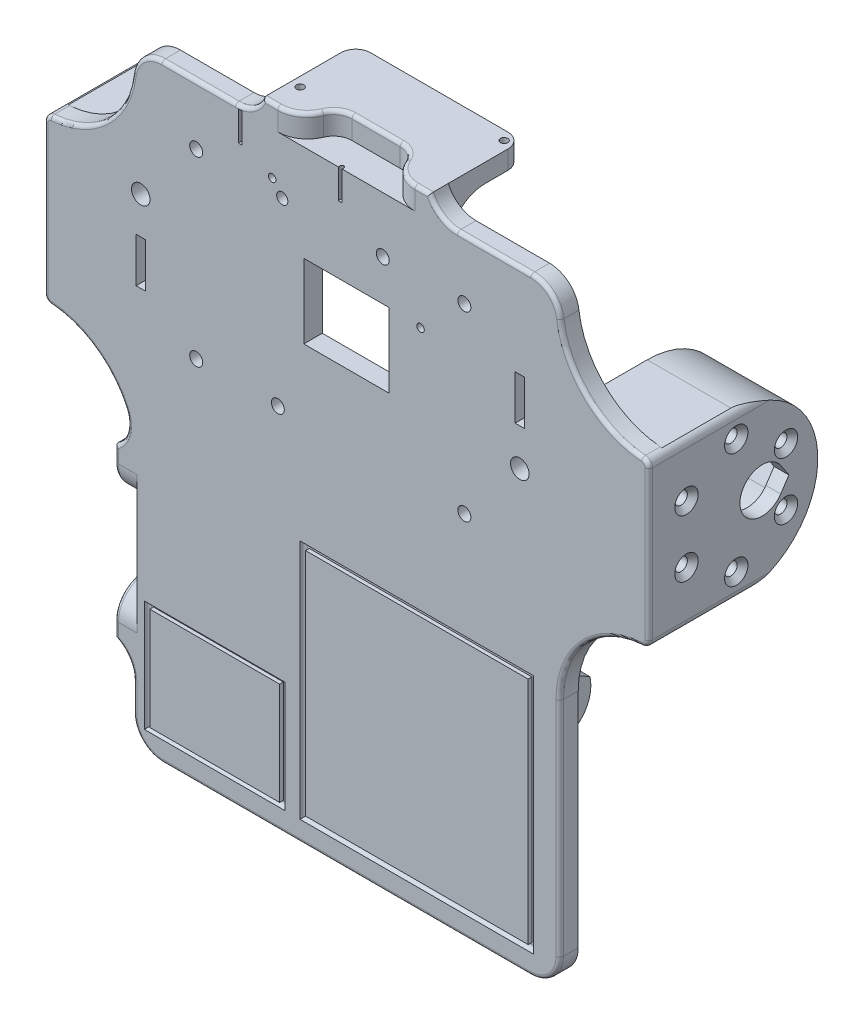
from build123d import *

# Parameters (mm, degrees)
SKETCH1_W                                      = 115
SKETCH1_H                                      = 100
SKETCH1_R                                      = 1.75
BOSS_EXTRUDE1_DEPTH                            = 5
SKETCH2_W                                      = 115
SKETCH2_H                                      = 64
BOSS_EXTRUDE2_DEPTH                            = 5
SKETCH4_W                                      = 45
SKETCH4_H                                      = 25
BOSS_EXTRUDE3_DEPTH                            = 5
SKETCH5_R                                      = 1
CUT_EXTRUDE2_DEPTH                             = 206.392307548
FILLET1_R                                      = 10
SKETCH6_R                                      = 2.25
CUT_EXTRUDE3_DEPTH                             = 202.298286133
SKETCH7_W                                      = 23
SKETCH7_H                                      = 8
CUT_EXTRUDE4_DEPTH                             = 6
SKETCH8_R                                      = 1
SKETCH8_W                                      = 23
SKETCH8_H                                      = 20
CUT_EXTRUDE5_DEPTH                             = 158.003184681
SKETCH9_R                                      = 18.5
BOSS_EXTRUDE4_DEPTH                            = 20
SKETCH10_R                                     = 6
BOSS_EXTRUDE5_DEPTH                            = 4
CSK_FOR_M3_FLAT_HEAD_MACHINE_SCREW1_AT_2_COUNT = 2
CSK_FOR_M3_FLAT_HEAD_MACHINE_SCREW1_AT_2_PITCH = 15.5
CSK_FOR_M3_FLAT_HEAD_MACHINE_SCREW1_AT_3_COUNT = 2
CSK_FOR_M3_FLAT_HEAD_MACHINE_SCREW1_AT_3_PITCH = 26.846787517
CSK_FOR_M3_FLAT_HEAD_MACHINE_SCREW1_AT_4_COUNT = 2
CSK_FOR_M3_FLAT_HEAD_MACHINE_SCREW1_AT_4_PITCH = 31
CSK_FOR_M3_FLAT_HEAD_MACHINE_SCREW1_AT_5_COUNT = 2
CSK_FOR_M3_FLAT_HEAD_MACHINE_SCREW1_AT_5_PITCH = 26.846787517
CSK_FOR_M3_FLAT_HEAD_MACHINE_SCREW1_AT_6_COUNT = 2
CSK_FOR_M3_FLAT_HEAD_MACHINE_SCREW1_AT_6_PITCH = 15.5
BOSS_EXTRUDE6_DEPTH                            = 5
SKETCH16_R                                     = 3.5
BOSS_EXTRUDE7_DEPTH                            = 10
FILLET3_R                                      = 20
FILLET4_R                                      = 5
SKETCH19_W                                     = 25
SKETCH19_H                                     = 45
BOSS_EXTRUDE9_DEPTH                            = 5
SKETCH20_R                                     = 1
CUT_EXTRUDE6_DEPTH                             = 5
FILLET5_R                                      = 10
SKETCH21_W                                     = 8
SKETCH21_H                                     = 23
CUT_EXTRUDE7_DEPTH                             = 6
SKETCH22_R                                     = 2.25
CUT_EXTRUDE8_DEPTH                             = 15
SKETCH23_R                                     = 2.5
SKETCH23_W                                     = 2.5
SKETCH23_H                                     = 12
CUT_EXTRUDE10_DEPTH                            = 22
SKETCH3_W                                      = 63
SKETCH3_H                                      = 65
SKETCH3_W_2                                    = 60
SKETCH3_H_2                                    = 62
SKETCH3_W_3                                    = 38
SKETCH3_H_3                                    = 30
SKETCH3_W_4                                    = 35
SKETCH3_H_4                                    = 27.631578948
CUT_EXTRUDE11_DEPTH                            = 1
FILLET6_R                                      = 1
FILLET7_R                                      = 5
CUT_EXTRUDE12_DEPTH                            = 20
CUT_EXTRUDE13_DEPTH                            = 196.511386402
CUT_EXTRUDE14_DEPTH                            = 20
CUT_EXTRUDE15_REACH                            = 152.551
FILLET8_R                                      = 8
FILLET9_R                                      = 4
CUT_EXTRUDE16_DEPTH                            = 181.908076505
FILLET10_R                                     = 1
SKETCH30_W                                     = 1
SKETCH30_H                                     = 8
CUT_EXTRUDE17_DEPTH                            = 1
FILLET11_R                                     = 0.5
SKETCH31_R                                     = 1.75
CUT_EXTRUDE18_DEPTH                            = 181.90807664
SKETCH32_R                                     = 2.5
SKETCH32_W                                     = 2.5
SKETCH32_H                                     = 12
CUT_EXTRUDE19_DEPTH                            = 181.90807664
SKETCH33_R                                     = 1.5
CUT_EXTRUDE20_DEPTH                            = 181.90807664


# Some blends are built 0.0001 mm under size
with BuildPart() as part:
    # Sketch1 → Boss-Extrude1 (new body)
    with BuildSketch(Plane.XY):
        with Locations((57.5, 50)):
            Rectangle(SKETCH1_W, SKETCH1_H)
        with Locations((67.3, 84)):
            Circle(SKETCH1_R, mode=Mode.SUBTRACT)
        with Locations((89.3, 35)):
            Circle(SKETCH1_R, mode=Mode.SUBTRACT)
        with Locations((17, 35)):
            Circle(SKETCH1_R, mode=Mode.SUBTRACT)
    extrude(amount=BOSS_EXTRUDE1_DEPTH)

    # Sketch2 → Boss-Extrude2 (add)
    with BuildSketch(Plane.XY.offset(5)):
        with Locations((57.5, -32)):
            Rectangle(SKETCH2_W, SKETCH2_H)
    extrude(amount=-BOSS_EXTRUDE2_DEPTH)

    # Sketch4 → Boss-Extrude3 (add)
    with BuildSketch(Plane(origin=(0, 100, 0), x_dir=(1, 0, 0), z_dir=(0, 1, 0))):
        with Locations((57.5, 7.5)):
            Rectangle(SKETCH4_W, SKETCH4_H)
    extrude(amount=BOSS_EXTRUDE3_DEPTH)

    # Sketch5 → Cut-Extrude2 (cut, through all)
    with BuildSketch(Plane(origin=(0, 105, 0), x_dir=(1, 0, 0), z_dir=(0, 1, 0))):
        with Locations(Location((37.5, 2.5, 0), (0, 0, 270))):
            Circle(SKETCH5_R)
        with Locations(Location((77.5, 17.5, 0), (0, 0, 270))):
            Circle(SKETCH5_R)
    extrude(amount=-CUT_EXTRUDE2_DEPTH, mode=Mode.SUBTRACT)

    # Fillet1
    # the kernel refuses this fillet: 10 mm, written as the material it adds along each edge
    with BuildSketch(Plane(origin=(80, 100, 0), x_dir=(0, -1, 0), z_dir=(-1, 0, 0))) as fillet1_piece_1_section:
        with BuildLine():
            CenterArc((FILLET1_R, -FILLET1_R), FILLET1_R, 90, 90)
            Line((0, -FILLET1_R), (0, 0))
            Line((0, 0), (FILLET1_R, 0))
        make_face()
    fillet1_piece_1 = extrude(amount=45, mode=Mode.PRIVATE)
    fillet1_piece_1 = fillet1_piece_1 - Plane(origin=(37.5, 100, -2.5), x_dir=(0, 0, 1), z_dir=(0, 1, 0)) * Cylinder(1, 130, mode=Mode.PRIVATE)
    add(fillet1_piece_1)

    # Sketch6 → Cut-Extrude3 (cut, through all)
    with BuildSketch(Plane.XZ.offset(-100)):
        with Locations(Location((37.5, -2.5, 0), (0, 0, 90))):
            Circle(SKETCH6_R)
    extrude(amount=CUT_EXTRUDE3_DEPTH, mode=Mode.SUBTRACT)

    # Sketch7 → Cut-Extrude4 (cut)
    with BuildSketch(Plane(origin=(0, 105, 0), x_dir=(1, 0, 0), z_dir=(0, 1, 0))):
        with Locations((57.5, -1)):
            Rectangle(SKETCH7_W, SKETCH7_H)
    extrude(amount=-CUT_EXTRUDE4_DEPTH, mode=Mode.SUBTRACT)

    # Sketch8 → Cut-Extrude5 (cut, through all)
    with BuildSketch(Plane(origin=(0, 0, 0), x_dir=(-1, 0, 0), z_dir=(0, 0, -1))):
        with Locations((-37.5, 87.5)):
            Circle(SKETCH8_R)
        with Locations((-77.5, 72.5)):
            Circle(SKETCH8_R)
        with Locations((-57.5, 63)):
            Rectangle(SKETCH8_W, SKETCH8_H)
    extrude(amount=-CUT_EXTRUDE5_DEPTH, mode=Mode.SUBTRACT)


with BuildPart() as body_2:
    # Sketch9 → Boss-Extrude4 (new body)
    with BuildSketch(Plane(origin=(115, 0, 0), x_dir=(0, 0, -1), z_dir=(1, 0, 0))):
        with BuildLine():
            Line((18.6, 72), (0, 72))
            Line((0, 72), (-5, 72))
            Line((-5, 72), (-5, 28))
            Line((-5, 28), (0, 28))
            Line((0, 28), (18.6, 28))
            ThreePointArc((18.6, 28), (40.6, 50), (18.6, 72))
        make_face()
        with Locations((18.6, 50)):
            Circle(SKETCH9_R, mode=Mode.SUBTRACT)
    boss_extrude4 = extrude(amount=BOSS_EXTRUDE4_DEPTH)

    # Sketch10 → Boss-Extrude5 (add)
    with BuildSketch(Plane(origin=(135, 0, 0), x_dir=(0, 0, -1), z_dir=(1, 0, 0))):
        with BuildLine():
            Line((-5, 28), (18.6, 28))
            ThreePointArc((18.6, 28), (40.6, 50), (18.6, 72))
            Line((18.6, 72), (-5, 72))
            Line((-5, 72), (-5, 28))
        make_face()
        with Locations((25.6, 50)):
            Circle(SKETCH10_R, mode=Mode.SUBTRACT)
    boss_extrude5 = extrude(amount=BOSS_EXTRUDE5_DEPTH)

    # Sketch12 → CSK for M3 Flat Head Machine Screw1 (revolve, cut)
    with BuildSketch(Plane(origin=(139, 57.75, -32.023393759), x_dir=(0, 0, -1), z_dir=(0, 1, 0))):
        Polygon((0, 0), (0, 139), (1.7, 139), (1.7, 1.45), (3.15, 0), align=None)
    csk_for_m3_flat_head_machine_screw1 = revolve(axis=Axis((145.35, 57.75, -32.023393759), (-1, 0, 0)), mode=Mode.SUBTRACT)

    # CSK for M3 Flat Head Machine Screw1 at 2: CSK for M3 Flat Head Machine Screw1 ×2
    with Locations(*[Vector(0, 0.500000000000113, 0.8660254037843734) * (i * CSK_FOR_M3_FLAT_HEAD_MACHINE_SCREW1_AT_2_PITCH) for i in range(1, CSK_FOR_M3_FLAT_HEAD_MACHINE_SCREW1_AT_2_COUNT)]):
        add(csk_for_m3_flat_head_machine_screw1, mode=Mode.SUBTRACT)

    # CSK for M3 Flat Head Machine Screw1 at 3: CSK for M3 Flat Head Machine Screw1 ×2
    with Locations(*[(0, 0, i * CSK_FOR_M3_FLAT_HEAD_MACHINE_SCREW1_AT_3_PITCH) for i in range(1, CSK_FOR_M3_FLAT_HEAD_MACHINE_SCREW1_AT_3_COUNT)]):
        add(csk_for_m3_flat_head_machine_screw1, mode=Mode.SUBTRACT)

    # CSK for M3 Flat Head Machine Screw1 at 4: CSK for M3 Flat Head Machine Screw1 ×2
    with Locations(*[Vector(0, -0.49999999999988537, 0.8660254037845048) * (i * CSK_FOR_M3_FLAT_HEAD_MACHINE_SCREW1_AT_4_PITCH) for i in range(1, CSK_FOR_M3_FLAT_HEAD_MACHINE_SCREW1_AT_4_COUNT)]):
        add(csk_for_m3_flat_head_machine_screw1, mode=Mode.SUBTRACT)

    # CSK for M3 Flat Head Machine Screw1 at 5: CSK for M3 Flat Head Machine Screw1 ×2
    with Locations(*[Vector(0, -0.8660254037843725, 0.5000000000001145) * (i * CSK_FOR_M3_FLAT_HEAD_MACHINE_SCREW1_AT_5_PITCH) for i in range(1, CSK_FOR_M3_FLAT_HEAD_MACHINE_SCREW1_AT_5_COUNT)]):
        add(csk_for_m3_flat_head_machine_screw1, mode=Mode.SUBTRACT)

    # CSK for M3 Flat Head Machine Screw1 at 6: CSK for M3 Flat Head Machine Screw1 ×2
    with Locations(*[(0, -i * CSK_FOR_M3_FLAT_HEAD_MACHINE_SCREW1_AT_6_PITCH, 0) for i in range(1, CSK_FOR_M3_FLAT_HEAD_MACHINE_SCREW1_AT_6_COUNT)]):
        add(csk_for_m3_flat_head_machine_screw1, mode=Mode.SUBTRACT)


with BuildPart() as part_1:
    add(part.part)

    # Mirror10: Boss-Extrude4, Boss-Extrude5, CSK for M3 Flat Head Machine Screw1 across plane
    add(boss_extrude4.mirror(Plane.ZY.offset(-57.5)))
    add(boss_extrude5.mirror(Plane.ZY.offset(-57.5)))
    add(csk_for_m3_flat_head_machine_screw1.mirror(Plane.ZY.offset(-57.5)), mode=Mode.SUBTRACT)

    # Mirror10 copy 1 sketch → Mirror10 copy 1 (revolve, cut)
    with BuildSketch(Plane(origin=(-24, 65.5, -18.6), x_dir=(0, 0, -1), z_dir=(0, 1, 0))):
        Polygon((0, 0), (0, -139), (1.7, -139), (1.7, -1.45), (3.15, 0), align=None)
    revolve(axis=Axis((-30.35, 65.5, -18.6), (-1, 0, 0)), mode=Mode.SUBTRACT)

    # Mirror10 copy 2 sketch → Mirror10 copy 2 (revolve, cut)
    with BuildSketch(Plane(origin=(-24, 57.75, -5.176606241), x_dir=(0, 0, -1), z_dir=(0, 1, 0))):
        Polygon((0, 0), (0, -139), (1.7, -139), (1.7, -1.45), (3.15, 0), align=None)
    revolve(axis=Axis((-30.35, 57.75, -5.176606241), (-1, 0, 0)), mode=Mode.SUBTRACT)

    # Mirror10 copy 3 sketch → Mirror10 copy 3 (revolve, cut)
    with BuildSketch(Plane(origin=(-24, 42.25, -5.176606241), x_dir=(0, 0, -1), z_dir=(0, 1, 0))):
        Polygon((0, 0), (0, -139), (1.7, -139), (1.7, -1.45), (3.15, 0), align=None)
    revolve(axis=Axis((-30.35, 42.25, -5.176606241), (-1, 0, 0)), mode=Mode.SUBTRACT)

    # Mirror10 copy 4 sketch → Mirror10 copy 4 (revolve, cut)
    with BuildSketch(Plane(origin=(-24, 34.5, -18.6), x_dir=(0, 0, -1), z_dir=(0, 1, 0))):
        Polygon((0, 0), (0, -139), (1.7, -139), (1.7, -1.45), (3.15, 0), align=None)
    revolve(axis=Axis((-30.35, 34.5, -18.6), (-1, 0, 0)), mode=Mode.SUBTRACT)

    # Mirror10 copy 5 sketch → Mirror10 copy 5 (revolve, cut)
    with BuildSketch(Plane(origin=(-24, 42.25, -32.023393759), x_dir=(0, 0, -1), z_dir=(0, 1, 0))):
        Polygon((0, 0), (0, -139), (1.7, -139), (1.7, -1.45), (3.15, 0), align=None)
    revolve(axis=Axis((-30.35, 42.25, -32.023393759), (-1, 0, 0)), mode=Mode.SUBTRACT)

    add(body_2.part)  # Boss-Extrude6 merges body 2
    # Sketch15 → Boss-Extrude6 (add)
    with BuildSketch(Plane(origin=(0, 0, 0), x_dir=(-1, 0, 0), z_dir=(0, 0, -1))):
        with BuildLine():
            Line((24, 72), (0, 72))
            Line((0, 72), (0, 96))
            ThreePointArc((0, 96), (7.029437252, 79.029437252), (24, 72))
        make_face()
        with BuildLine():
            Line((24, 28), (0, 28))
            Line((0, 28), (0, 4))
            ThreePointArc((0, 4), (7.029437252, 20.970562748), (24, 28))
        make_face()
        with BuildLine():
            Line((-115, 4), (-115, 28))
            Line((-115, 28), (-139, 28))
            ThreePointArc((-139, 28), (-122.029437252, 20.970562748), (-115, 4))
        make_face()
        with BuildLine():
            Line((-115, 96), (-115, 72))
            Line((-115, 72), (-139, 72))
            ThreePointArc((-139, 72), (-122.029437252, 79.029437252), (-115, 96))
        make_face()
    extrude(amount=-BOSS_EXTRUDE6_DEPTH)

    # Sketch16 → Boss-Extrude7 (add)
    with BuildSketch(Plane.ZY.offset(-50.4)):
        with BuildLine():
            Line((0, -9.511734706), (-32.831780912, -28.467172254))
            Line((-32.831780912, -28.467172254), (-43.545593688, -34.652794944))
            ThreePointArc((-43.545593688, -34.652794944), (-42.536532248, -41.57021305), (-37.05040316, -45.902794944))
            Line((-37.05040316, -45.902794944), (-28.173771731, -40.777869399))
            Line((-28.173771731, -40.777869399), (0, -24.511734706))
            Line((0, -24.511734706), (0, -9.511734706))
        make_face()
        with Locations((-34.35, -36.843716453)):
            Circle(SKETCH16_R, mode=Mode.SUBTRACT)
    boss_extrude7 = extrude(amount=BOSS_EXTRUDE7_DEPTH)

    # Mirror11: Boss-Extrude7 across plane
    add(boss_extrude7.mirror(Plane.ZY.offset(-57.5)))

    # Fillet3
    fillet3_edges = [part_1.edges().sort_by_distance(p)[0] for p in [
        (40.4, -17.011734706, 0),
        (74.6, -17.011734706, 0),
    ]]
    fillet(fillet3_edges, radius=FILLET3_R)

    # Fillet4
    fillet4_edges = [part_1.edges().sort_by_distance(p)[0] for p in [
        (35.4, -24.511734706, 0),
        (79.6, -24.511734706, 0),
        (35.4, -9.511734706, 0),
        (79.6, -9.511734706, 0),
    ]]
    fillet(fillet4_edges, radius=FILLET4_R)

    # Sketch19 → Boss-Extrude9 (add)
    with BuildSketch(Plane.ZY):
        with Locations((-7.5, -18.5)):
            Rectangle(SKETCH19_W, SKETCH19_H)
    extrude(amount=BOSS_EXTRUDE9_DEPTH)

    # Sketch20 → Cut-Extrude6 (cut)
    with BuildSketch(Plane.ZY.offset(5)):
        with Locations((-17.5, 1.5)):
            Circle(SKETCH20_R)
        with Locations((-2.5, -38.5)):
            Circle(SKETCH20_R)
    extrude(amount=-CUT_EXTRUDE6_DEPTH, mode=Mode.SUBTRACT)

    # Fillet5
    # the kernel refuses this fillet: 10 mm, written as the material it adds along each edge
    with BuildSketch(Plane(origin=(0, -41, 0), x_dir=(1, 0, 0), z_dir=(0, 1, 0))) as fillet5_piece_1_section:
        with BuildLine():
            CenterArc((FILLET5_R, FILLET5_R), FILLET5_R, 180, 90)
            Line((0, FILLET5_R), (0, 0))
            Line((0, 0), (FILLET5_R, 0))
        make_face()
    fillet5_piece_1 = extrude(amount=45, mode=Mode.PRIVATE)
    fillet5_piece_1 = fillet5_piece_1 - Plane(origin=(0, -38.5, -2.5), x_dir=(0, 0, 1), z_dir=(-1, 0, 0)) * Cylinder(1, 130, mode=Mode.PRIVATE)
    add(fillet5_piece_1)

    # Sketch21 → Cut-Extrude7 (cut)
    with BuildSketch(Plane.ZY.offset(5)):
        with Locations((1, -18.5)):
            Rectangle(SKETCH21_W, SKETCH21_H)
    extrude(amount=-CUT_EXTRUDE7_DEPTH, mode=Mode.SUBTRACT)

    # Sketch22 → Cut-Extrude8 (cut)
    with BuildSketch(Plane(origin=(0, 0, 0), x_dir=(0, 0, -1), z_dir=(1, 0, 0))):
        with Locations(Location((2.5, -38.5, 0), (0, 0, 180))):
            Circle(SKETCH22_R)
    extrude(amount=CUT_EXTRUDE8_DEPTH, mode=Mode.SUBTRACT)

    # Sketch23 → Cut-Extrude10 (cut)
    with BuildSketch(Plane.XY.offset(5)):
        with Locations((104.25, 53)):
            Circle(SKETCH23_R)
        with Locations((104.25, 69)):
            Rectangle(SKETCH23_W, SKETCH23_H)
    extrude(amount=-CUT_EXTRUDE10_DEPTH, mode=Mode.SUBTRACT)

    # Sketch3 → Cut-Extrude11 (cut)
    # profile 1 of 2: a face of its own
    with BuildSketch(Plane.XY.offset(5)):
        with Locations((76.5, -26)):
            Rectangle(SKETCH3_W, SKETCH3_H)
        with Locations((76.5, -26)):
            Rectangle(SKETCH3_W_2, SKETCH3_H_2, mode=Mode.SUBTRACT)
    # profile 2 of 2: a face of its own
    with BuildSketch(Plane.XY.offset(5)):
        with Locations((22, -43.5)):
            Rectangle(SKETCH3_W_3, SKETCH3_H_3)
        with Locations((22, -43.5)):
            Rectangle(SKETCH3_W_4, SKETCH3_H_4, mode=Mode.SUBTRACT)
    extrude(amount=-CUT_EXTRUDE11_DEPTH, mode=Mode.SUBTRACT)

    # Fillet6
    fillet6_edges = [part_1.edges().sort_by_distance(p)[0] for p in [
        (76.5, -58.5, 4),
        (108, -26, 4),
        (76.5, 6.5, 4),
        (45, -26, 4),
        (22, -58.5, 4),
        (41, -43.5, 4),
        (22, -28.5, 4),
        (3, -43.5, 4),
    ]]
    fillet(fillet6_edges, radius=FILLET6_R - 0.0001)  # a hair under: the kernel refuses the full size

    # Fillet7
    fillet7_edges = [part_1.edges().sort_by_distance(p)[0] for p in [
        (46, 102, -3),
        (69, 102, -3),
        (-2, -30, -3),
        (-2, -7, -3),
    ]]
    fillet(fillet7_edges, radius=FILLET7_R)

    # Sketch24 → Cut-Extrude12 (cut)
    with BuildSketch(Plane.ZY.offset(-115)):
        with BuildLine():
            Line((-35.056989836, 41.549113328), (-39.396634343, 50))
            Line((-39.396634343, 50), (-35.056989836, 58.450886672))
            ThreePointArc((-35.056989836, 58.450886672), (-37.1, 50), (-35.056989836, 41.549113328))
        make_face()
    extrude(amount=-CUT_EXTRUDE12_DEPTH, mode=Mode.SUBTRACT)

    # Sketch25 → Cut-Extrude13 (cut, through all)
    with BuildSketch(Plane.ZY.offset(-135)):
        with BuildLine():
            Line((-30.592301766, 46.671798823), (-32.811102551, 50))
            Line((-32.811102551, 50), (-30.592301766, 53.328201177))
            ThreePointArc((-30.592301766, 53.328201177), (-31.6, 50), (-30.592301766, 46.671798823))
        make_face()
    cut_extrude13 = extrude(amount=-CUT_EXTRUDE13_DEPTH, mode=Mode.SUBTRACT)

    # Mirror14: Cut-Extrude13 across plane
    add(cut_extrude13.mirror(Plane.ZY.offset(-57.5)), mode=Mode.SUBTRACT)

    # Sketch26 → Cut-Extrude14 (cut)
    with BuildSketch(Plane(origin=(0, 0, 0), x_dir=(0, 0, -1), z_dir=(1, 0, 0))):
        with BuildLine():
            Line((35.056989836, 58.450886672), (39.396634343, 50))
            Line((39.396634343, 50), (35.056989836, 41.549113328))
            ThreePointArc((35.056989836, 41.549113328), (37.1, 50), (35.056989836, 58.450886672))
        make_face()
    extrude(amount=-CUT_EXTRUDE14_DEPTH, mode=Mode.SUBTRACT)

    # Cut-Extrude15: up to this face of the body (flat: up to its plane)
    cut_extrude15_end = Plane(part_1.part.faces().sort_by_distance((40.4, -34.236342604, -30.563620444))[0])
    # Sketch27 → Cut-Extrude15 (cut, up to the picked face)
    with BuildSketch(Plane(origin=(74.6, 0, 0), x_dir=(0, 0, -1), z_dir=(1, 0, 0)), mode=Mode.PRIVATE) as cut_extrude15_sk1:
        with BuildLine():
            Line((36.654766128, -39.477734884), (39.665072906, -36.843716453))
            Line((39.665072906, -36.843716453), (36.654766128, -34.209698021))
            ThreePointArc((36.654766128, -34.209698021), (37.85, -36.843716453), (36.654766128, -39.477734884))
        make_face()
    cut_extrude15_tool1 = split(extrude(cut_extrude15_sk1.sketch, amount=-CUT_EXTRUDE15_REACH, mode=Mode.PRIVATE), bisect_by=cut_extrude15_end, keep=Keep.BOTH, mode=Mode.PRIVATE)
    add(cut_extrude15_tool1.solids().sort_by(Axis((74.6, -36.843716, -38.292316), (-1, 0, 0)))[0], mode=Mode.SUBTRACT)

    # Fillet8
    # the kernel refuses this fillet: 8 mm, written as the material it adds along each edge
    with BuildSketch(Plane(origin=(80, 100, 5), x_dir=(1, 0, 0), z_dir=(0, 0, -1)), Plane(origin=(35, 100, 0), x_dir=(-1, 0, 0), z_dir=(0, 0, 1))) as fillet8_piece_1:
        with BuildLine():
            CenterArc((7.416198487, -8), FILLET8_R, 90, 67.975687163)
            Line((0, -5), (0, 0))
            Line((0, 0), (7.416198487, 0))
        make_face()
    extrude(amount=5)
    with BuildSketch(Plane(origin=(0, -41, 0), x_dir=(-1, 0, 0), z_dir=(0, 0, 1))) as fillet8_piece_2:
        with BuildLine():
            CenterArc((8, 7.416198487), FILLET8_R, 180, 67.975687163)
            Line((0, 7.416198487), (0, 0))
            Line((0, 0), (5, 0))
        make_face()
    extrude(amount=5)
    with BuildSketch(Plane(origin=(0, 4, 0), x_dir=(-0.2126740773058503, 0.9771231943015708, 0), z_dir=(0, 0, 1))) as fillet8_piece_3:
        with BuildLine():
            CenterArc((8.506963092, 7.816985554), FILLET8_R, 201.495071849, 80.784034357)
            Line((1.063370387, 4.885615972), (0, 0))
            ThreePointArc((0, 0), (5.104177855, -0.549043337), (10.208355711, 0))
        make_face()
    extrude(amount=5)
    # the kernel refuses this fillet: 8 mm, written as the material it takes off along each edge
    with BuildSketch(Plane(origin=(0, 100, -19.372539332), x_dir=(1, 0, 0), z_dir=(0, 0, 1))) as fillet8_2_piece_1:
        with BuildLine():
            CenterArc((7.749015733, -8), FILLET8_R, 90, 82.819244219)
            Line((-0.1882382, -7), (-0.981963594, -6.9))
            ThreePointArc((-0.981963594, -6.9), (-0.8, -4), (-0.8, 0))
            Line((-0.8, 0), (0, 0.8))
            Line((0, 0.8), (7.749015733, 0.8))
            Line((7.749015733, 0.8), (7.749015733, 0))
        make_face()
    extrude(amount=43.745078664, mode=Mode.SUBTRACT)
    with BuildSketch(Plane(origin=(115, 100, -19.372539332), x_dir=(0.026881453783434036, -0.9996386284265374, 0), z_dir=(0, 0, 1))) as fillet8_2_piece_2:
        with BuildLine():
            CenterArc((7.788804219, -7.961267089), FILLET8_R, 95.640376378, 82.819244219)
            Line((-0.208304808, -7.746215459), (-1.008015711, -7.724710296))
            Line((-1.008015711, -7.724710296), (-0.799710903, 0.021505163))
            Line((-0.799710903, 0.021505163), (0.021505163, 0.799710903))
            ThreePointArc((0.021505163, 0.799710903), (4.020059677, 0.692185088), (6.923903145, 0.796126709))
            Line((6.923903145, 0.796126709), (7.002530515, 0))
        make_face()
    extrude(amount=43.745078664, mode=Mode.SUBTRACT)
    with BuildSketch(Plane(origin=(115, -64, 25), x_dir=(-1, 0, 0), z_dir=(0, 0, -1)), Plane(origin=(0, -64, 25), x_dir=(0, 1, 0), z_dir=(0, 0, -1))) as fillet8_2_piece_3:
        with BuildLine():
            CenterArc((FILLET8_R, FILLET8_R), FILLET8_R, 180, 90)
            Line((0, FILLET8_R), (0, 0))
            Line((0, 0), (FILLET8_R, 0))
        make_face()
    extrude(amount=45, mode=Mode.SUBTRACT)
    with BuildSketch(Plane(origin=(46, 122.5, 5), x_dir=(0.07788766729290894, 0, -0.9969621413492437), z_dir=(0, -1, 0)), Plane(origin=(-22.5, -30, 5), x_dir=(0, 0.07788766729290754, -0.9969621413492438), z_dir=(1, 0, 0))) as fillet8_2_piece_4:
        with BuildLine():
            CenterArc((7.43048346, -7.601836328), FILLET8_R, 108.152705887, 67.380135052)
            Line((-0.545213671, -6.978734989), (-1.342783384, -6.916424856))
            Line((-1.342783384, -6.916424856), (-0.797569713, 0.062310134))
            Line((-0.797569713, 0.062310134), (0.062310134, 0.797569713))
            ThreePointArc((0.062310134, 0.797569713), (3.053196558, 0.563906711), (4.688837571, 0.760183633))
            Line((4.688837571, 0.760183633), (4.938078106, 0))
        make_face()
    extrude(amount=23.5, mode=Mode.SUBTRACT)
    with BuildSketch(Plane(origin=(69, 122.5, 5), x_dir=(1, 0, 0), z_dir=(0, -1, 0))) as fillet8_2_piece_5:
        with BuildLine():
            CenterArc((7, -8), FILLET8_R, 90, 67.380135052)
            Line((-0.384615385, -4.923076923), (-1.123076923, -4.615384615))
            ThreePointArc((-1.123076923, -4.615384615), (-0.8, -3), (-0.8, 0))
            Line((-0.8, 0), (0, 0.8))
            Line((0, 0.8), (7, 0.8))
            Line((7, 0.8), (7, 0))
        make_face()
    extrude(amount=23.5, mode=Mode.SUBTRACT)
    with BuildSketch(Plane(origin=(-22.5, -7, 5), x_dir=(0, -0.07788766729290758, -0.9969621413492437), z_dir=(1, 0, 0))) as fillet8_2_piece_6:
        with BuildLine():
            CenterArc((7.43048346, 7.601836328), FILLET8_R, 184.467159061, 67.380135052)
            Line((-0.545213671, 6.978734989), (-1.342783384, 6.916424856))
            Line((-1.342783384, 6.916424856), (-0.797569713, -0.062310134))
            Line((-0.797569713, -0.062310134), (0.062310134, -0.797569713))
            ThreePointArc((0.062310134, -0.797569713), (3.053196558, -0.563906711), (4.688837571, -0.760183633))
            Line((4.688837571, -0.760183633), (4.938078106, 0))
        make_face()
    extrude(amount=23.5, mode=Mode.SUBTRACT)

    # Fillet9
    fillet9_edges = [part_1.edges().sort_by_distance(p)[0] for p in [
        (35, 102.5, -20),
        (80, 102.5, -20),
        (-2.5, -41, -20),
        (-2.5, 4, -20),
    ]]
    fillet(fillet9_edges, radius=FILLET9_R)

    # Sketch28 → Cut-Extrude16 (cut, through all)
    with BuildSketch(Plane.XY.offset(5)):
        with BuildLine():
            Line((-24, 72), (-24, 70.077037206))
            ThreePointArc((-24, 70.077037206), (-23.467598771, 71.435769647), (-22.153846154, 72.071111267))
            ThreePointArc((-22.153846154, 72.071111267), (-23.076238554, 72.017784406), (-24, 72))
        make_face()
        with BuildLine():
            Line((139, 72), (139, 70.077037206))
            ThreePointArc((139, 70.077037206), (138.467598771, 71.435769647), (137.153846154, 72.071111267))
            ThreePointArc((137.153846154, 72.071111267), (138.076238554, 72.017784406), (139, 72))
        make_face()
        with BuildLine():
            Line((139, 29.922962794), (139, 28))
            ThreePointArc((139, 28), (138.076238554, 27.982215594), (137.153846154, 27.928888733))
            ThreePointArc((137.153846154, 27.928888733), (138.467598771, 28.564230353), (139, 29.922962794))
        make_face()
        with BuildLine():
            Line((-24, 29.922962794), (-24, 28))
            ThreePointArc((-24, 28), (-23.076238554, 27.982215594), (-22.153846154, 27.928888733))
            ThreePointArc((-22.153846154, 27.928888733), (-23.467598771, 28.564230353), (-24, 29.922962794))
        make_face()
    extrude(amount=-CUT_EXTRUDE16_DEPTH, mode=Mode.SUBTRACT)

    # Fillet10
    fillet10_edges = [part_1.edges().sort_by_distance(p)[0] for p in [
        (37, 105, 5),
        (-5, -39, 5),
        (57.5, 105, -3),
        (-5, -18.5, -3),
        (66.773500981, 105, -2.160251472),
        (-5, -9.226499019, -2.160251472),
        (0, -52.208099244, 5),
        (57.5, -64, 5),
        (115, -26, 5),
        (97.333591377, 100, 5),
        (78, 105, 5),
        (17.666408623, 100, 5),
        (-7.444434328, 78.624349069, 5),
        (-5, 2, 5),
        (2.343145751, -61.656854249, 5),
        (112.656854249, -61.656854249, 5),
        (112.542486889, 98, 5),
        (2.457513111, 98, 5),
        (48.226499019, 105, -2.160251472),
        (71.56239843, 105, 3.656402355),
        (43.43760157, 105, 3.656402355),
        (-5, -27.773500981, -2.160251472),
        (-5, -32.56239843, 3.656402355),
        (-5, -4.43760157, 3.656402355),
        (82.944062532, 101.366750419, 5),
        (32.055937468, 101.366750419, 5),
        (-1.366750419, -43.944062532, 5),
        (-1.750910985, 8.46709746, 5),
        (122.444434328, 78.624349069, 5),
        (-10.259308425, 23.67723037, 5),
        (139, 50, 5),
        (-24, 50, 5),
        (138.467598771, 28.564230353, 5),
        (138.467598771, 71.435769647, 5),
        (-23.467598771, 71.435769647, 5),
        (-23.467598771, 28.564230353, 5),
        (121.388814743, 20.304789292, 5),
    ]]
    fillet(fillet10_edges, radius=FILLET10_R)

    # Sketch30 → Cut-Extrude17 (cut)
    with BuildSketch(Plane.XY.offset(5)):
        with Locations((28.86, 95.1)):
            Rectangle(SKETCH30_W, SKETCH30_H)
        with Locations((55.8, 95.1)):
            Rectangle(SKETCH30_W, SKETCH30_H)
    extrude(amount=-CUT_EXTRUDE17_DEPTH, mode=Mode.SUBTRACT)

    # Fillet11
    fillet11_edges = [part_1.edges().sort_by_distance(p)[0] for p in [
        (56.3, 95.05, 4),
        (55.3, 95.05, 4),
        (29.36, 95.1, 4),
        (28.36, 95.1, 4),
    ]]
    fillet(fillet11_edges, radius=FILLET11_R - 0.0001)  # a hair under: the kernel refuses the full size

    # Sketch31 → Cut-Extrude18 (cut, through all)
    with BuildSketch(Plane.XY.offset(5)):
        with Locations((67.3, 84)):
            Circle(SKETCH31_R)
        with Locations(Location((89.3, 84, 0), (0, 0, 180))):
            Circle(SKETCH31_R)
        with Locations(Location((17, 84, 0), (0, 0, 180))):
            Circle(SKETCH31_R)
        with Locations((39, 35)):
            Circle(SKETCH31_R)
    extrude(amount=-CUT_EXTRUDE18_DEPTH, mode=Mode.SUBTRACT)

    # Sketch32 → Cut-Extrude19 (cut, through all)
    with BuildSketch(Plane.XY.offset(5)):
        with Locations((2.05, 66)):
            Circle(SKETCH32_R)
        with Locations((2.05, 50)):
            Rectangle(SKETCH32_W, SKETCH32_H)
    extrude(amount=-CUT_EXTRUDE19_DEPTH, mode=Mode.SUBTRACT)

    # Sketch33 → Cut-Extrude20 (cut, through all)
    with BuildSketch(Plane.XY.offset(5)):
        with Locations((40.1957, 84.105)):
            Circle(SKETCH33_R)
    extrude(amount=-CUT_EXTRUDE20_DEPTH, mode=Mode.SUBTRACT)


solid = part_1.part
